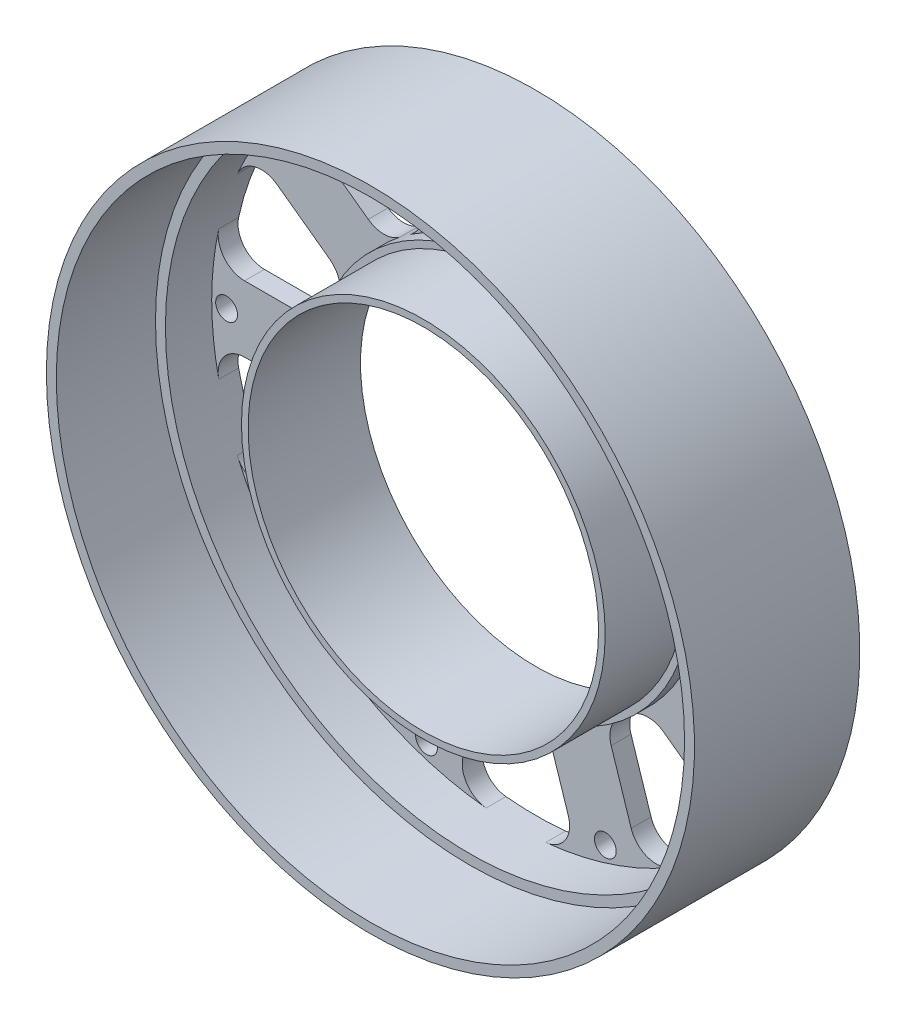
from build123d import *

# Parameters (mm, degrees)
SKETCH1_R             = 27.5
SKETCH1_R_2           = 26.5
BOSS_EXTRUDE2_DEPTH   = 12
BOSS_EXTRUDE3_START   = -5
SKETCH1_3_R           = 28.5
SKETCH1_3_R_2         = 26.5
BOSS_EXTRUDE3_DEPTH   = 5
BOSS_EXTRUDE4_DEPTH   = 3
SKETCH3_3_R           = 49
BOSS_EXTRUDE5_DEPTH   = 25
SKETCH3_5_R           = 47.5
SKETCH3_5_R_2         = 46
BOSS_EXTRUDE6_DEPTH   = 10
FILLET1_R             = 4
M4X0_7_TAPPED_HOLE1_D = 3.3
CIRPATTERN1_COUNT     = 10


with BuildPart() as part:
    # Sketch1 → Boss-Extrude2 (new body)
    with BuildSketch(Plane.XY):
        Circle(SKETCH1_R)
        Circle(SKETCH1_R_2, mode=Mode.SUBTRACT)
    extrude(amount=BOSS_EXTRUDE2_DEPTH)

    # Sketch1<3> → Boss-Extrude3 (add)
    with BuildSketch(Plane.XY.offset(BOSS_EXTRUDE3_START)):
        Circle(SKETCH1_3_R)
        Circle(SKETCH1_3_R_2, mode=Mode.SUBTRACT)
    extrude(amount=BOSS_EXTRUDE3_DEPTH)

    # Sketch3 → Boss-Extrude4 (add)
    with BuildSketch(Plane(origin=(0, 0, -5), x_dir=(-1, 0, 0), z_dir=(0, 0, -1))):
        with BuildLine():
            ThreePointArc((28.057975693, 5), (28.5, 0), (28.057975693, -5))
            Line((28.057975693, -5), (47.236109069, -5))
            ThreePointArc((47.236109069, -5), (47.5, 0), (47.236109069, 5))
            Line((47.236109069, 5), (28.057975693, 5))
        make_face()
        with BuildLine():
            ThreePointArc((19.760452902, 20.537149294), (23.05698434, 16.75187969), (25.638305425, 12.44697935))
            Line((25.638305425, 12.44697935), (41.153741247, 23.719603315))
            ThreePointArc((41.153741247, 23.719603315), (38.428307233, 27.919799484), (35.275888724, 31.809773258))
            Line((35.275888724, 31.809773258), (19.760452902, 20.537149294))
        make_face()
        with BuildLine():
            ThreePointArc((25.638305425, -12.44697935), (23.05698434, -16.75187969), (19.760452902, -20.537149294))
            Line((19.760452902, -20.537149294), (35.275888724, -31.809773258))
            ThreePointArc((35.275888724, -31.809773258), (38.428307233, -27.919799484), (41.153741247, -23.719603315))
            Line((41.153741247, -23.719603315), (25.638305425, -12.44697935))
        make_face()
        with BuildLine():
            ThreePointArc((3.915108735, 28.229805589), (8.80698434, 27.105110714), (13.425673898, 25.139635645))
            Line((13.425673898, 25.139635645), (19.352043032, 43.379124363))
            ThreePointArc((19.352043032, 43.379124363), (14.678307233, 45.175184524), (9.841477869, 46.469294307))
            Line((9.841477869, 46.469294307), (3.915108735, 28.229805589))
        make_face()
        with BuildLine():
            ThreePointArc((13.425673898, -25.139635645), (8.80698434, -27.105110714), (3.915108735, -28.229805589))
            Line((3.915108735, -28.229805589), (9.841477869, -46.469294307))
            ThreePointArc((9.841477869, -46.469294307), (14.678307233, -45.175184524), (19.352043032, -43.379124363))
            Line((19.352043032, -43.379124363), (13.425673898, -25.139635645))
        make_face()
        with BuildLine():
            ThreePointArc((-13.425673898, 25.139635645), (-8.80698434, 27.105110714), (-3.915108735, 28.229805589))
            Line((-3.915108735, 28.229805589), (-9.841477869, 46.469294307))
            ThreePointArc((-9.841477869, 46.469294307), (-14.678307233, 45.175184524), (-19.352043032, 43.379124363))
            Line((-19.352043032, 43.379124363), (-13.425673898, 25.139635645))
        make_face()
        with BuildLine():
            ThreePointArc((-3.915108735, -28.229805589), (-8.80698434, -27.105110714), (-13.425673898, -25.139635645))
            Line((-13.425673898, -25.139635645), (-19.352043032, -43.379124363))
            ThreePointArc((-19.352043032, -43.379124363), (-14.678307233, -45.175184524), (-9.841477869, -46.469294307))
            Line((-9.841477869, -46.469294307), (-3.915108735, -28.229805589))
        make_face()
        with BuildLine():
            ThreePointArc((-25.638305425, 12.44697935), (-23.05698434, 16.75187969), (-19.760452902, 20.537149294))
            Line((-19.760452902, 20.537149294), (-35.275888724, 31.809773258))
            ThreePointArc((-35.275888724, 31.809773258), (-38.428307233, 27.919799484), (-41.153741247, 23.719603315))
            Line((-41.153741247, 23.719603315), (-25.638305425, 12.44697935))
        make_face()
        with BuildLine():
            ThreePointArc((-19.760452902, -20.537149294), (-23.05698434, -16.75187969), (-25.638305425, -12.44697935))
            Line((-25.638305425, -12.44697935), (-41.153741247, -23.719603315))
            ThreePointArc((-41.153741247, -23.719603315), (-38.428307233, -27.919799484), (-35.275888724, -31.809773258))
            Line((-35.275888724, -31.809773258), (-19.760452902, -20.537149294))
        make_face()
        with BuildLine():
            ThreePointArc((-28.057975693, -5), (-28.5, 0), (-28.057975693, 5))
            Line((-28.057975693, 5), (-47.236109069, 5))
            ThreePointArc((-47.236109069, 5), (-47.5, 0), (-47.236109069, -5))
            Line((-47.236109069, -5), (-28.057975693, -5))
        make_face()
    extrude(amount=-BOSS_EXTRUDE4_DEPTH)

    # Sketch3<3> → Boss-Extrude5 (add)
    with BuildSketch(Plane(origin=(0, 0, -5), x_dir=(-1, 0, 0), z_dir=(0, 0, -1))):
        Circle(SKETCH3_3_R)
        with BuildLine():
            ThreePointArc((41.153741247, 23.719603315), (45.175184524, 14.678307233), (47.236109069, 5))
            ThreePointArc((47.236109069, 5), (47.433981389, 2.5034795), (47.5, 0))
            ThreePointArc((47.5, 0), (47.433981389, -2.5034795), (47.236109069, -5))
            ThreePointArc((47.236109069, -5), (45.175184524, -14.678307233), (41.153741247, -23.719603315))
            ThreePointArc((41.153741247, -23.719603315), (38.428307233, -27.919799484), (35.275888724, -31.809773258))
            ThreePointArc((35.275888724, -31.809773258), (27.919799484, -38.428307233), (19.352043032, -43.379124363))
            ThreePointArc((19.352043032, -43.379124363), (14.678307233, -45.175184524), (9.841477869, -46.469294307))
            ThreePointArc((9.841477869, -46.469294307), (0, -47.5), (-9.841477869, -46.469294307))
            ThreePointArc((-9.841477869, -46.469294307), (-14.678307233, -45.175184524), (-19.352043032, -43.379124363))
            ThreePointArc((-19.352043032, -43.379124363), (-27.919799484, -38.428307233), (-35.275888724, -31.809773258))
            ThreePointArc((-35.275888724, -31.809773258), (-38.428307233, -27.919799484), (-41.153741247, -23.719603315))
            ThreePointArc((-41.153741247, -23.719603315), (-45.175184524, -14.678307233), (-47.236109069, -5))
            ThreePointArc((-47.236109069, -5), (-47.5, 0), (-47.236109069, 5))
            ThreePointArc((-47.236109069, 5), (-45.175184524, 14.678307233), (-41.153741247, 23.719603315))
            ThreePointArc((-41.153741247, 23.719603315), (-38.428307233, 27.919799484), (-35.275888724, 31.809773258))
            ThreePointArc((-35.275888724, 31.809773258), (-27.919799484, 38.428307233), (-19.352043032, 43.379124363))
            ThreePointArc((-19.352043032, 43.379124363), (-14.678307233, 45.175184524), (-9.841477869, 46.469294307))
            ThreePointArc((-9.841477869, 46.469294307), (0, 47.5), (9.841477869, 46.469294307))
            ThreePointArc((9.841477869, 46.469294307), (14.678307233, 45.175184524), (19.352043032, 43.379124363))
            ThreePointArc((19.352043032, 43.379124363), (27.919799484, 38.428307233), (35.275888724, 31.809773258))
            ThreePointArc((35.275888724, 31.809773258), (38.428307233, 27.919799484), (41.153741247, 23.719603315))
        make_face(mode=Mode.SUBTRACT)
    extrude(amount=-BOSS_EXTRUDE5_DEPTH)

    # Sketch3<5> → Boss-Extrude6 (add)
    with BuildSketch(Plane(origin=(0, 0, -5), x_dir=(-1, 0, 0), z_dir=(0, 0, -1))):
        Circle(SKETCH3_5_R)
        Circle(SKETCH3_5_R_2, mode=Mode.SUBTRACT)
    extrude(amount=-BOSS_EXTRUDE6_DEPTH)

    # Fillet1
    fillet1_edges = [part.edges().sort_by_distance(p)[0] for p in [
        (-34.055360698, 30.923007741, -3.5),
        (-18.88584281, 41.944307616, -3.5),
        (-13.425673898, 25.139635645, -3.5),
        (-19.760452902, 20.537149294, -3.5),
        (-39.933213221, 22.832837797, -3.5),
        (-45.727453461, 5, -3.5),
        (-25.638305425, 12.44697935, -3.5),
        (-28.057975693, 5, -3.5),
        (-39.933213221, -22.832837797, -3.5),
        (-45.727453461, -5, -3.5),
        (-28.057975693, -5, -3.5),
        (-25.638305425, -12.44697935, -3.5),
        (-19.760452902, -20.537149294, -3.5),
        (-13.425673898, -25.139635645, -3.5),
        (-18.88584281, -41.944307616, -3.5),
        (-34.055360698, -30.923007741, -3.5),
        (-9.375277647, -45.034477559, -3.5),
        (-3.915108735, -28.229805589, -3.5),
        (3.915108735, -28.229805589, -3.5),
        (9.375277647, -45.034477559, -3.5),
        (18.88584281, -41.944307615, -3.5),
        (34.055360698, -30.923007741, -3.5),
        (19.760452902, -20.537149294, -3.5),
        (13.425673898, -25.139635645, -3.5),
        (28.057975693, -5, -3.5),
        (25.638305425, -12.44697935, -3.5),
        (45.727453461, -5, -3.5),
        (39.933213221, -22.832837797, -3.5),
        (28.057975693, 5, -3.5),
        (25.638305425, 12.44697935, -3.5),
        (39.933213221, 22.832837797, -3.5),
        (45.727453461, 5, -3.5),
        (19.760452902, 20.537149294, -3.5),
        (13.425673898, 25.139635645, -3.5),
        (18.88584281, 41.944307615, -3.5),
        (34.055360698, 30.923007741, -3.5),
        (-3.915108735, 28.229805589, -3.5),
        (3.915108735, 28.229805589, -3.5),
        (-9.375277647, 45.034477559, -3.5),
        (9.375277647, 45.034477559, -3.5),
    ]]
    fillet(fillet1_edges, radius=FILLET1_R)

    # M4x0.7 Tapped Hole1 (through all)
    with Locations(Plane(origin=(0, 0, -5), x_dir=(-1, 0, 0), z_dir=(0, 0, -1))):
        with Locations((43.75, 0)):
            m4x0_7_tapped_hole1 = Hole(M4X0_7_TAPPED_HOLE1_D / 2)

    # CirPattern1: M4x0.7 Tapped Hole1 ×10 about axis
    cirpattern1_axis = Axis((0, 0, 1000), (0, 0, -1))
    for i in range(1, CIRPATTERN1_COUNT):
        add(m4x0_7_tapped_hole1.rotate(cirpattern1_axis, i * 360 / CIRPATTERN1_COUNT), mode=Mode.SUBTRACT)


solid = part.part
